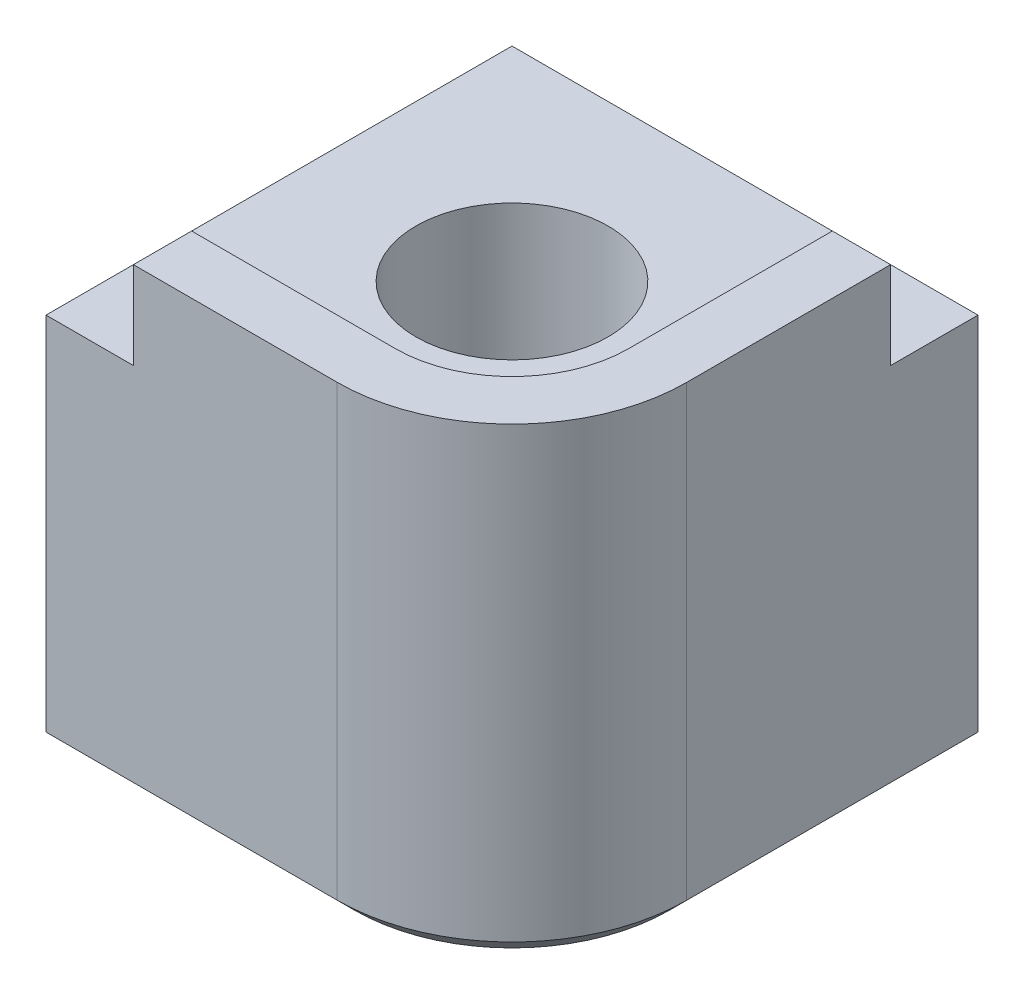
from build123d import *

# Parameters (mm, degrees)
BASE_W              = 8
BASE_H              = 8
BOSS_EXTRUDE1_DEPTH = 8
CUTOUT_W            = 7
CUTOUT_H            = 7
CUT_EXTRUDE1_DEPTH  = 1.5
SKETCH3_W           = 1.5
SKETCH3_H           = 1.5
CUT_EXTRUDE2_DEPTH  = 12.357816692
FILLET3_R           = 2
FILLET4_R           = 3
M4_TAPPED_HOLE1_D   = 3.3
CHAMFER1_SIZE       = 0.3


with BuildPart() as part:
    # Base → Boss-Extrude1 (new body)
    with BuildSketch(Plane(origin=(0, 0, 0), x_dir=(1, 0, 0), z_dir=(0, 1, 0))):
        Rectangle(BASE_W, BASE_H)
    extrude(amount=-BOSS_EXTRUDE1_DEPTH)

    # Cutout → Cut-Extrude1 (cut)
    with BuildSketch(Plane(origin=(0, 0, 0), x_dir=(1, 0, 0), z_dir=(0, 1, 0))):
        with Locations((-0.5, 0.5)):
            Rectangle(CUTOUT_W, CUTOUT_H)
    extrude(amount=-CUT_EXTRUDE1_DEPTH, mode=Mode.SUBTRACT)

    # Sketch3 → Cut-Extrude2 (cut, through all)
    with BuildSketch(Plane.ZY.offset(-3)):
        with Locations((-3.25, -0.75)):
            Rectangle(SKETCH3_W, SKETCH3_H)
    cut_extrude2 = extrude(amount=-CUT_EXTRUDE2_DEPTH, mode=Mode.SUBTRACT)

    # Mirror1: Cut-Extrude2 across plane
    add(cut_extrude2.mirror(Plane(origin=(0, 0, 0), x_dir=(0.7071067811865476, 0, 0.7071067811865475), z_dir=(0.7071067811865475, 0, -0.7071067811865476))), mode=Mode.SUBTRACT)

    # Fillet3
    fillet3_edges = [part.edges().sort_by_distance(p)[0] for p in [
        (3, -0.75, 3),
    ]]
    fillet(fillet3_edges, radius=FILLET3_R)

    # Fillet4
    fillet4_edges = [part.edges().sort_by_distance(p)[0] for p in [
        (4, -4, 4),
    ]]
    fillet(fillet4_edges, radius=FILLET4_R)

    # M4 Tapped Hole1 (through all)
    with Locations(Plane(origin=(0, -1.5, 0), x_dir=(1, 0, 0), z_dir=(0, 1, 0))):
        with Locations((-0.5, 0.5)):
            Hole(M4_TAPPED_HOLE1_D / 2)

    # Chamfer1
    chamfer1_edges = [part.edges().sort_by_distance(p)[0] for p in [
        (-4, -8, 0),
        (-1.5, -8, 4),
        (3.121320344, -8, 3.121320344),
        (4, -8, -1.5),
        (0, -8, -4),
    ]]
    chamfer(chamfer1_edges, length=CHAMFER1_SIZE)


solid = part.part
